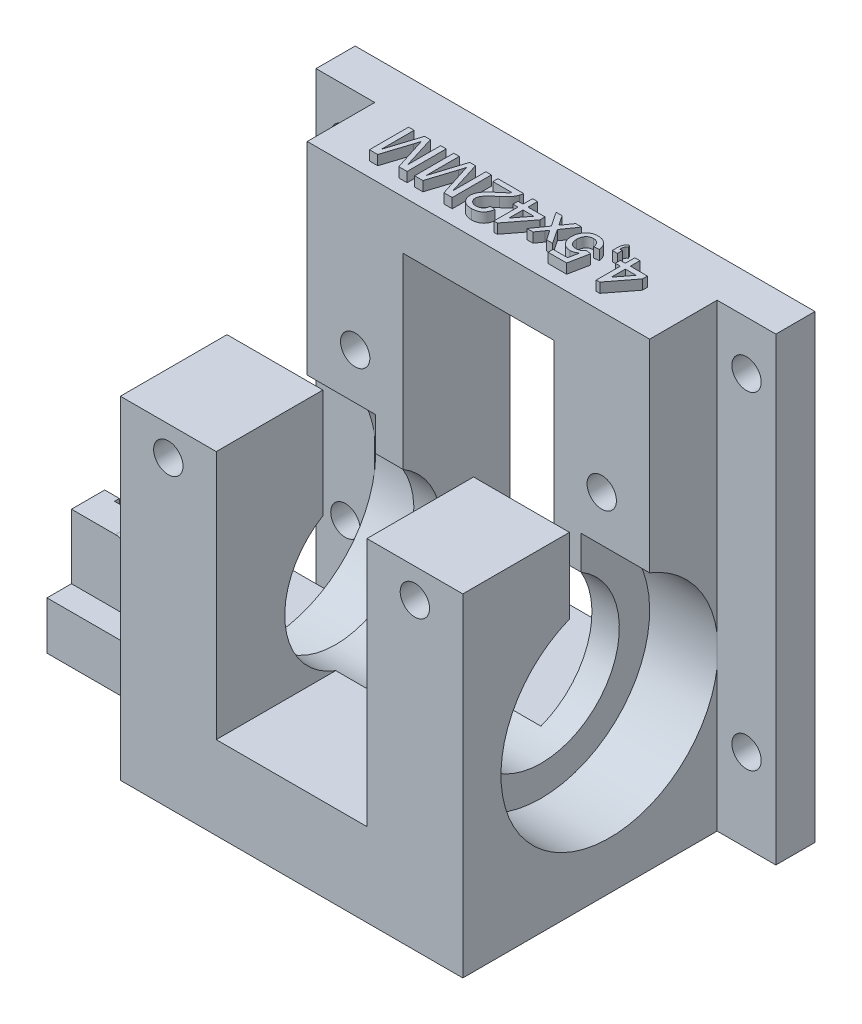
from build123d import *

# Parameters (mm, degrees)
SKETCH_1_W           = 35
SKETCH_1_H           = 30
EXTRUDE_1_DEPTH      = 42
SKETCH_2_W           = 15.4
SKETCH_2_H           = 30
CUT_EXTRUDE_1_DEPTH  = 33.5
SKETCH_3_R           = 11.1
CUT_EXTRUDE_2_DEPTH  = 7
CUT_EXTRUDE_START    = -7
SKETCH_4_R           = 11.1
CUT_EXTRUDE_3_DEPTH  = 7
SKETCH_5_R           = 8
CUT_EXTRUDE_4_DEPTH  = 53.659282183
SKETCH_6_W           = 35
SKETCH_6_H           = 8.2
CUT_EXTRUDE_5_DEPTH  = 20
SKETCH_7_R           = 1.5
CUT_EXTRUDE_6_DEPTH  = 55.5
SKETCH_9_W           = 15
SKETCH_9_H           = 4.9
EXTRUDE_2_DEPTH      = 15
SKETCH_10_W          = 6
SKETCH_10_H          = 10
EXTRUDE_3_DEPTH      = 6.6
CUT_EXTRUDE_8_DEPTH  = 1.3
SKETCH_12_W          = 3.2
SKETCH_12_H          = 10.2
CUT_EXTRUDE_9_DEPTH  = 1
SKETCH_14_W          = 35
SKETCH_14_H          = 10.9
EXTRUDE_4_DEPTH      = 5
SKETCH_15_W          = 9.8
SKETCH_15_H          = 10.9
CUT_EXTRUDE_10_DEPTH = 8
EXTRUDE_5_DEPTH      = 1
SKETCH_23_W          = 4
SKETCH_23_H          = 47
EXTRUDE_7_DEPTH      = 6
SKETCH_25_W          = 4
SKETCH_25_H          = 47
EXTRUDE_8_DEPTH      = 6
SKETCH_26_R          = 1.5
CUT_EXTRUDE_12_DEPTH = 66.270590694
SKETCH_27_R          = 3
CUT_EXTRUDE_13_DEPTH = 3
FILLET1_R            = 1.5


with BuildPart() as part:
    # Эскиз1 → Бобышка-Вытянуть1 (new body)
    with BuildSketch(Plane(origin=(0, 0, 0), x_dir=(1, 0, 0), z_dir=(0, 1, 0))):
        Rectangle(SKETCH_1_W, SKETCH_1_H)
    extrude(amount=EXTRUDE_1_DEPTH)

    # Эскиз2 → Вырез-Вытянуть1 (cut)
    with BuildSketch(Plane(origin=(0, 42, 0), x_dir=(1, 0, 0), z_dir=(0, 1, 0))):
        Rectangle(SKETCH_2_W, SKETCH_2_H)
    extrude(amount=-CUT_EXTRUDE_1_DEPTH, mode=Mode.SUBTRACT)

    # Эскиз3 → Вырез-Вытянуть2 (cut)
    with BuildSketch(Plane.ZY.offset(17.5)):
        with Locations((0, 16)):
            Circle(SKETCH_3_R)
    extrude(amount=-CUT_EXTRUDE_2_DEPTH, mode=Mode.SUBTRACT)

    # Эскиз4 → Вырез-Вытянуть3 (cut)
    with BuildSketch(Plane(origin=(17.5, 0, 0), x_dir=(0, 0, -1), z_dir=(1, 0, 0)).offset(CUT_EXTRUDE_START)):
        with Locations(Location((0, 16, 0), (0, 0, 180))):
            Circle(SKETCH_4_R)
    extrude(amount=CUT_EXTRUDE_3_DEPTH, mode=Mode.SUBTRACT)

    # Эскиз5 → Вырез-Вытянуть4 (cut, through all)
    with BuildSketch(Plane.ZY.offset(10.5)):
        with Locations((0, 16)):
            Circle(SKETCH_5_R)
    extrude(amount=-CUT_EXTRUDE_4_DEPTH, mode=Mode.SUBTRACT)

    # Эскиз6 → Вырез-Вытянуть5 (cut)
    with BuildSketch(Plane(origin=(0, 42, 0), x_dir=(1, 0, 0), z_dir=(0, 1, 0))):
        Rectangle(SKETCH_6_W, SKETCH_6_H)
    extrude(amount=-CUT_EXTRUDE_5_DEPTH, mode=Mode.SUBTRACT)

    # Эскиз7 → Вырез-Вытянуть6 (cut, through all)
    with BuildSketch(Plane(origin=(0, 0, -15), x_dir=(-1, 0, 0), z_dir=(0, 0, -1))):
        with Locations((-12.6, 31)):
            Circle(SKETCH_7_R)
        with Locations((12.6, 31)):
            Circle(SKETCH_7_R)
    extrude(amount=-CUT_EXTRUDE_6_DEPTH, mode=Mode.SUBTRACT)

    # Эскиз9 → Бобышка-Вытянуть2 (add)
    with BuildSketch(Plane(origin=(-17.5, 0, 0), x_dir=(0, 0, -1), z_dir=(1, 0, 0))):
        with Locations((0, 2.45)):
            Rectangle(SKETCH_9_W, SKETCH_9_H)
    extrude(amount=-EXTRUDE_2_DEPTH)

    # Эскиз10 → Бобышка-Вытянуть3 (add)
    with BuildSketch(Plane(origin=(0, 4.9, 0), x_dir=(1, 0, 0), z_dir=(0, 1, 0))):
        with Locations((-29.5, 0)):
            Rectangle(SKETCH_10_W, SKETCH_10_H)
    extrude(amount=EXTRUDE_3_DEPTH)

    # Эскиз11 → Вырез-Вытянуть8 (cut)
    with BuildSketch(Plane(origin=(0, 11.5, 0), x_dir=(1, 0, 0), z_dir=(0, 1, 0))):
        Polygon((-31, 1.6), (-32.5, 1.6), (-32.5, -1.6), (-31, -1.6), (-31, -2.1), (-28, -2.1), (-28, 2.1), (-31, 2.1), align=None)
    extrude(amount=-CUT_EXTRUDE_8_DEPTH, mode=Mode.SUBTRACT)

    # Эскиз12 → Вырез-Вытянуть9 (cut)
    with BuildSketch(Plane.ZY.offset(32.5)):
        with Locations((0, 5.1)):
            Rectangle(SKETCH_12_W, SKETCH_12_H)
    extrude(amount=-CUT_EXTRUDE_9_DEPTH, mode=Mode.SUBTRACT)

    # Эскиз14 → Бобышка-Вытянуть4 (add)
    with BuildSketch(Plane(origin=(0, 42, 0), x_dir=(1, 0, 0), z_dir=(0, 1, 0))):
        with Locations((0, 9.55)):
            Rectangle(SKETCH_14_W, SKETCH_14_H)
    extrude(amount=EXTRUDE_4_DEPTH)

    # Эскиз15 → Вырез-Вытянуть10 (cut)
    with BuildSketch(Plane(origin=(0, 42, 0), x_dir=(1, 0, 0), z_dir=(0, 1, 0))):
        with Locations((-12.6, -9.55)):
            Rectangle(SKETCH_15_W, SKETCH_15_H)
        with Locations((12.6, -9.55)):
            Rectangle(SKETCH_15_W, SKETCH_15_H)
    extrude(amount=-CUT_EXTRUDE_10_DEPTH, mode=Mode.SUBTRACT)

    # Эскиз17 → Бобышка-Вытянуть5 (add)
    # profile 1 of 8: a face of its own
    with BuildSketch(Plane(origin=(0, 47, 0), x_dir=(1, 0, 0), z_dir=(0, 1, 0))):
        Polygon((11.051282051, 9.55), (11.051282051, 8.575641026), (12.794871795, 8.575641026), (12.794871795, 8.062820513), (10.897435897, 5.601282051), (10.538461538, 5.601282051), (10.538461538, 8.062820513), (10.025641026, 8.062820513), (10.025641026, 8.575641026), (10.538461538, 8.575641026), (10.538461538, 9.55), align=None)
        Polygon((11.051282051, 8.062820513), (11.051282051, 6.622115385), (12.161858974, 8.062820513), align=None, mode=Mode.SUBTRACT)
    # profile 2 of 8: a face of its own
    with BuildSketch(Plane(origin=(0, 47, 0), x_dir=(1, 0, 0), z_dir=(0, 1, 0))):
        with BuildLine():
            Line((9.256410256, 9.55), (9.256410256, 9.037179487))
            Line((9.256410256, 9.037179487), (8.743589744, 9.037179487))
            Line((8.743589744, 9.037179487), (8.743589744, 9.55))
            add(Edge.make_bspline(
                [(8.743589744, 9.55), (8.744762203, 9.60080674), (8.746998436, 9.697710464), (8.765236115, 9.835295888), (8.795282204, 9.957567435), (8.837586451, 10.066022105), (8.895741676, 10.16039483), (8.967235433, 10.243648121), (9.053922116, 10.314994822), (9.120081135, 10.351752907), (9.153846154, 10.370512821)],
                knots=[0, 0, 0, 0, 1.252840278, 2.389542986, 3.415356866, 4.352460491, 5.24846073, 6.135967884, 7.048669687, 8, 8, 8, 8], degree=3))
            Line((9.153846154, 10.370512821), (9.256410256, 10.165384615))
            add(Edge.make_bspline(
                [(9.256410256, 10.165384615), (9.236136991, 10.15270943), (9.195793548, 10.127486034), (9.144116682, 10.077328516), (9.100530598, 10.019236479), (9.065074864, 9.951439544), (9.038948006, 9.871529248), (9.019447544, 9.777755567), (9.005956084, 9.668947552), (9.003109603, 9.591175547), (9.001602564, 9.55)],
                knots=[0, 0, 0, 0, 0.818684612, 1.629167986, 2.454191951, 3.302962822, 4.242204463, 5.329983798, 6.586388792, 8, 8, 8, 8], degree=3))
            Line((9.001602564, 9.55), (9.256410256, 9.55))
        make_face()
    # profile 3 of 8: a face of its own
    with BuildSketch(Plane(origin=(0, 47, 0), x_dir=(1, 0, 0), z_dir=(0, 1, 0))):
        with BuildLine():
            Line((7.974358974, 8.473076923), (7.461538462, 8.421794872))
            add(Edge.make_bspline(
                [(7.461538462, 8.421794872), (7.456460733, 8.450689493), (7.446583762, 8.506894026), (7.427762102, 8.588251754), (7.403318124, 8.663835357), (7.375852623, 8.734299433), (7.343205242, 8.798898912), (7.307831533, 8.858653786), (7.266115474, 8.911442943), (7.222256638, 8.960027307), (7.174118215, 9.002838723), (7.121235704, 9.038930225), (7.065084563, 9.070417874), (7.004980891, 9.096198562), (6.940832572, 9.115068668), (6.873456044, 9.129991683), (6.801983712, 9.137511319), (6.753218627, 9.138989984), (6.728365385, 9.13974359)],
                knots=[0, 0, 0, 0, 1.237781394, 2.407677316, 3.51963579, 4.58689595, 5.594855907, 6.570874, 7.510833816, 8.428091223, 9.330271693, 10.221190844, 11.124215526, 12.043132878, 12.973586933, 13.941700858, 14.950982896, 16, 16, 16, 16], degree=3))
            add(Edge.make_bspline(
                [(6.728365385, 9.13974359), (6.697879298, 9.138998436), (6.638262427, 9.137541256), (6.551476168, 9.125474441), (6.469793796, 9.104984114), (6.392440011, 9.078387527), (6.320650702, 9.041973623), (6.254638587, 8.99701751), (6.192074052, 8.946020266), (6.136594245, 8.885375865), (6.086108178, 8.81931477), (6.042530672, 8.747217103), (6.005845696, 8.670082001), (5.974960646, 8.587927748), (5.952154369, 8.500284059), (5.935378488, 8.40761745), (5.924609047, 8.309868818), (5.923594873, 8.242870598), (5.923076923, 8.208653846)],
                knots=[0, 0, 0, 0, 1.052750423, 2.05869932, 3.018624241, 3.958205853, 4.878289862, 5.789216265, 6.712947111, 7.659433357, 8.620775926, 9.5811884, 10.56329027, 11.567503128, 12.60809625, 13.686605721, 14.818523251, 16, 16, 16, 16], degree=3))
            add(Edge.make_bspline(
                [(5.923076923, 8.208653846), (5.923665617, 8.176045727), (5.92481194, 8.112550156), (5.934465851, 8.020090048), (5.950753135, 7.933149565), (5.971827355, 7.850770472), (6.00087551, 7.774240043), (6.035328257, 7.702448663), (6.077534321, 7.636919954), (6.124491351, 7.575613592), (6.178122208, 7.520654908), (6.239151436, 7.47424926), (6.305184894, 7.433634947), (6.377552563, 7.400699273), (6.456297057, 7.376229304), (6.540635873, 7.357401866), (6.631444151, 7.347499404), (6.69388974, 7.3457634), (6.725961538, 7.344871795)],
                knots=[0, 0, 0, 0, 1.165854935, 2.270189951, 3.319242023, 4.32700288, 5.306253956, 6.24172124, 7.169108591, 8.088047231, 8.999810445, 9.905349262, 10.822648491, 11.767237767, 12.739852311, 13.766490849, 14.852878837, 16, 16, 16, 16], degree=3))
            add(Edge.make_bspline(
                [(6.725961538, 7.344871795), (6.765831836, 7.346075377), (6.842557476, 7.348391528), (6.952581265, 7.366774493), (7.052239813, 7.397884441), (7.141490161, 7.441871146), (7.221133837, 7.496136836), (7.292349446, 7.558219874), (7.357127652, 7.626487707), (7.39247764, 7.677959269), (7.41025641, 7.703846154)],
                knots=[0, 0, 0, 0, 1.182595606, 2.275764447, 3.298426239, 4.269611407, 5.217028086, 6.149744883, 7.069440711, 8, 8, 8, 8], degree=3))
            Line((7.41025641, 7.703846154), (7.923076923, 7.652564103))
            Line((7.923076923, 7.652564103), (7.512820513, 5.601282051))
            Line((7.512820513, 5.601282051), (5.615384615, 5.601282051))
            Line((5.615384615, 5.601282051), (5.615384615, 6.114102564))
            Line((5.615384615, 6.114102564), (7.09375, 6.114102564))
            Line((7.09375, 6.114102564), (7.297275641, 7.150160256))
            add(Edge.make_bspline(
                [(7.297275641, 7.150160256), (7.268978306, 7.128929634), (7.213406817, 7.087236051), (7.126747153, 7.032591296), (7.038983143, 6.986841178), (6.950576337, 6.948546155), (6.860301127, 6.919728313), (6.769141059, 6.899121223), (6.676964847, 6.88537448), (6.615166257, 6.884015656), (6.584134615, 6.883333333)],
                knots=[0, 0, 0, 0, 1.093799738, 2.148049664, 3.164132611, 4.152263193, 5.124065093, 6.089950765, 7.040884846, 8, 8, 8, 8], degree=3))
            add(Edge.make_bspline(
                [(6.584134615, 6.883333333), (6.543748064, 6.884391846), (6.464217151, 6.886476314), (6.347021786, 6.903592241), (6.234978069, 6.932674585), (6.127137436, 6.971751814), (6.025308421, 7.023832328), (5.927334208, 7.085605854), (5.835155558, 7.16005899), (5.748365663, 7.244413035), (5.669029336, 7.337778469), (5.600276379, 7.439053291), (5.541050547, 7.546436856), (5.493068907, 7.660316925), (5.456004725, 7.780892463), (5.429974508, 7.907543666), (5.413427229, 8.040751555), (5.411329647, 8.131680793), (5.41025641, 8.178205128)],
                knots=[0, 0, 0, 0, 0.991915953, 1.953323076, 2.9018799, 3.831962974, 4.765165785, 5.70629427, 6.67268229, 7.670376632, 8.67608782, 9.677121355, 10.672677061, 11.684236821, 12.707498642, 13.766656378, 14.857300131, 16, 16, 16, 16], degree=3))
            add(Edge.make_bspline(
                [(5.41025641, 8.178205128), (5.411156001, 8.222583072), (5.412932951, 8.310242175), (5.427752663, 8.439380631), (5.451534872, 8.564053302), (5.485561261, 8.683683722), (5.527786942, 8.799330016), (5.581285743, 8.909565964), (5.642451314, 9.016580163), (5.691606696, 9.082518807), (5.716346154, 9.115705128)],
                knots=[0, 0, 0, 0, 1.059762356, 2.093333049, 3.100576568, 4.08823236, 5.061210495, 6.037154334, 7.012117566, 8, 8, 8, 8], degree=3))
            add(Edge.make_bspline(
                [(5.716346154, 9.115705128), (5.747771179, 9.154439921), (5.809587576, 9.230635417), (5.916555204, 9.329653668), (6.031909427, 9.413416188), (6.154974873, 9.483107829), (6.287290682, 9.536524881), (6.428159547, 9.573425407), (6.577145806, 9.597839493), (6.679387351, 9.600118743), (6.731570513, 9.601282051)],
                knots=[0, 0, 0, 0, 1.023063757, 2.01247625, 2.982117532, 3.944599247, 4.908953799, 5.902627458, 6.929519989, 8, 8, 8, 8], degree=3))
            add(Edge.make_bspline(
                [(6.731570513, 9.601282051), (6.774615114, 9.600406486), (6.858818996, 9.598693703), (6.98212694, 9.583877782), (7.099337418, 9.560077146), (7.210909624, 9.526516179), (7.315783802, 9.48202305), (7.415429606, 9.429357654), (7.507610872, 9.365184154), (7.594184528, 9.293303776), (7.67336044, 9.213562045), (7.743516838, 9.126412248), (7.804411227, 9.03273972), (7.858083566, 8.933562687), (7.899810221, 8.826848145), (7.934761175, 8.714806315), (7.960674347, 8.596312118), (7.969749603, 8.514586039), (7.974358974, 8.473076923)],
                knots=[0, 0, 0, 0, 1.109091339, 2.169605288, 3.195665858, 4.188679546, 5.166738875, 6.127665597, 7.0881237, 8.055905583, 9.024592931, 9.979285586, 10.933953421, 11.900951517, 12.880148814, 13.881763063, 14.92413606, 16, 16, 16, 16], degree=3))
        make_face()
    # profile 4 of 8: a face of its own
    with BuildSketch(Plane(origin=(0, 47, 0), x_dir=(1, 0, 0), z_dir=(0, 1, 0))):
        with BuildLine():
            Line((5.102564103, 9.55), (4.076923077, 8.088461538))
            Line((4.076923077, 8.088461538), (5.051282051, 6.626923077))
            Line((5.051282051, 6.626923077), (4.436698718, 6.626923077))
            Line((4.436698718, 6.626923077), (3.963141026, 7.336057692))
            add(Edge.make_bspline(
                [(3.963141026, 7.336057692), (3.943145685, 7.366263796), (3.905403959, 7.423278603), (3.851487363, 7.503520103), (3.804239172, 7.574051249), (3.774842718, 7.617843871), (3.761217949, 7.638141026)],
                knots=[0, 0, 0, 0, 1.196329119, 2.258102392, 3.192659312, 4, 4, 4, 4], degree=3))
            add(Edge.make_bspline(
                [(3.761217949, 7.638141026), (3.728351968, 7.591408991), (3.662834044, 7.498249262), (3.597476074, 7.404977245), (3.564903846, 7.35849359)],
                knots=[0, 0, 0, 0, 1.003266858, 2, 2, 2, 2], degree=3))
            Line((3.564903846, 7.35849359), (3.051282051, 6.626923077))
            Line((3.051282051, 6.626923077), (2.4375, 6.626923077))
            Line((2.4375, 6.626923077), (3.462339744, 8.087660256))
            Line((3.462339744, 8.087660256), (2.487179487, 9.55))
            Line((2.487179487, 9.55), (3.101762821, 9.55))
            Line((3.101762821, 9.55), (3.670673077, 8.696634615))
            Line((3.670673077, 8.696634615), (3.778044872, 8.537980769))
            Line((3.778044872, 8.537980769), (4.487980769, 9.55))
            Line((4.487980769, 9.55), (5.102564103, 9.55))
        make_face()
    # profile 5 of 8: a face of its own
    with BuildSketch(Plane(origin=(0, 47, 0), x_dir=(1, 0, 0), z_dir=(0, 1, 0))):
        Polygon((0.58974359, 9.55), (0.58974359, 8.575641026), (2.333333333, 8.575641026), (2.333333333, 8.062820513), (0.435897436, 5.601282051), (0.076923077, 5.601282051), (0.076923077, 8.062820513), (-0.435897436, 8.062820513), (-0.435897436, 8.575641026), (0.076923077, 8.575641026), (0.076923077, 9.55), align=None)
        Polygon((0.58974359, 8.062820513), (0.58974359, 6.622115385), (1.700320513, 8.062820513), align=None, mode=Mode.SUBTRACT)
    # profile 6 of 8: a face of its own
    with BuildSketch(Plane(origin=(0, 47, 0), x_dir=(1, 0, 0), z_dir=(0, 1, 0))):
        with BuildLine():
            Line((-3.461538462, 9.037179487), (-3.461538462, 9.55))
            Line((-3.461538462, 9.55), (-0.846153846, 9.55))
            add(Edge.make_bspline(
                [(-0.846153846, 9.55), (-0.846082735, 9.519519453), (-0.845941371, 9.458926348), (-0.856451896, 9.368959417), (-0.872291123, 9.280102742), (-0.890639052, 9.222910301), (-0.899839744, 9.194230769)],
                knots=[0, 0, 0, 0, 1.010600758, 2.009000657, 3.001600101, 4, 4, 4, 4], degree=3))
            add(Edge.make_bspline(
                [(-0.899839744, 9.194230769), (-0.916779692, 9.147353172), (-0.951190909, 9.052127668), (-1.021694058, 8.914539873), (-1.104395846, 8.777782713), (-1.18460512, 8.665929608), (-1.25815358, 8.577261327), (-1.318832327, 8.507068152), (-1.387177214, 8.4361128), (-1.461952315, 8.36313594), (-1.542700917, 8.288131646), (-1.629420726, 8.210750893), (-1.723168438, 8.13246432), (-1.7886128, 8.080571583), (-1.822115385, 8.05400641)],
                knots=[0, 0, 0, 0, 1.204775845, 2.447339333, 3.731688634, 5.069474332, 5.771881205, 6.518320379, 7.313534551, 8.154278236, 9.045805008, 9.979490009, 10.965651065, 12, 12, 12, 12], degree=3))
            add(Edge.make_bspline(
                [(-1.822115385, 8.05400641), (-1.873583803, 8.010686271), (-1.972689508, 7.927270595), (-2.112642371, 7.803489508), (-2.240466257, 7.688551596), (-2.354126908, 7.580443046), (-2.454550075, 7.480210154), (-2.541983882, 7.388087306), (-2.617141923, 7.304339128), (-2.679226482, 7.226005854), (-2.731197355, 7.152053321), (-2.776319435, 7.080316644), (-2.812541985, 7.008283907), (-2.843626375, 6.937323066), (-2.867741932, 6.867153892), (-2.884713823, 6.797147878), (-2.895681037, 6.727967714), (-2.896857451, 6.681716305), (-2.897435897, 6.658974359)],
                knots=[0, 0, 0, 0, 1.782511555, 3.432339066, 4.950556168, 6.337242158, 7.588364383, 8.709771971, 9.70247892, 10.569050646, 11.3564271, 12.096888545, 12.812232926, 13.490631961, 14.148641375, 14.7751826, 15.397753892, 16, 16, 16, 16], degree=3))
            add(Edge.make_bspline(
                [(-2.897435897, 6.658974359), (-2.896879163, 6.636494046), (-2.89578688, 6.592388895), (-2.885421202, 6.527842176), (-2.87099607, 6.465678688), (-2.847656894, 6.40703374), (-2.819938503, 6.350109704), (-2.784024488, 6.296761456), (-2.743372767, 6.244972349), (-2.695881727, 6.197454776), (-2.64437183, 6.152921146), (-2.587038785, 6.115707339), (-2.52657792, 6.083233275), (-2.462464322, 6.05676427), (-2.39421562, 6.036629538), (-2.32231158, 6.022524983), (-2.246489973, 6.01342694), (-2.194738127, 6.012177498), (-2.168269231, 6.011538462)],
                knots=[0, 0, 0, 0, 0.987999173, 1.938400644, 2.870175051, 3.788745887, 4.708217872, 5.649938364, 6.61138593, 7.600013579, 8.600369295, 9.600725011, 10.599354487, 11.616065131, 12.645726306, 13.724038792, 14.835941382, 16, 16, 16, 16], degree=3))
            add(Edge.make_bspline(
                [(-2.168269231, 6.011538462), (-2.140465958, 6.012178615), (-2.086052911, 6.013431441), (-2.006502895, 6.022505424), (-1.931031689, 6.036484496), (-1.859837716, 6.057377903), (-1.79343005, 6.085090247), (-1.730298763, 6.116672913), (-1.672120047, 6.155686717), (-1.61882603, 6.200662994), (-1.569496464, 6.249756283), (-1.527853004, 6.305255231), (-1.491169963, 6.364389666), (-1.462860375, 6.429200021), (-1.439189909, 6.497660549), (-1.422317066, 6.570946029), (-1.413059075, 6.648857951), (-1.411204191, 6.702220684), (-1.41025641, 6.729487179)],
                knots=[0, 0, 0, 0, 1.131007971, 2.213465715, 3.25352735, 4.250693176, 5.225400803, 6.177988609, 7.118348849, 8.067272485, 9.012455277, 9.942714685, 10.883890855, 11.837222194, 12.81320114, 13.828092093, 14.890230783, 16, 16, 16, 16], degree=3))
            Line((-1.41025641, 6.729487179), (-0.897435897, 6.678205128))
            add(Edge.make_bspline(
                [(-0.897435897, 6.678205128), (-0.902682148, 6.633511111), (-0.912888276, 6.546562747), (-0.938322126, 6.420640269), (-0.973985758, 6.303468047), (-1.016806537, 6.193542674), (-1.070028073, 6.092144418), (-1.132080914, 5.998963916), (-1.201772535, 5.912932004), (-1.281651179, 5.837210809), (-1.36861221, 5.769133514), (-1.463516346, 5.710944199), (-1.565313196, 5.660697713), (-1.674316407, 5.620003899), (-1.7905577, 5.588840701), (-1.913835182, 5.566554173), (-2.044294277, 5.552801079), (-2.133779886, 5.550947015), (-2.179487179, 5.55)],
                knots=[0, 0, 0, 0, 1.130828508, 2.199929528, 3.223633236, 4.205997909, 5.160910297, 6.095620583, 7.016241394, 7.937376102, 8.855913919, 9.787436367, 10.73018861, 11.705300542, 12.706861604, 13.751074331, 14.851297925, 16, 16, 16, 16], degree=3))
            add(Edge.make_bspline(
                [(-2.179487179, 5.55), (-2.225741232, 5.550792323), (-2.315844398, 5.552335771), (-2.447141617, 5.568119175), (-2.571015121, 5.592720915), (-2.687960685, 5.626942232), (-2.797357101, 5.672137793), (-2.899578502, 5.726571863), (-2.99430275, 5.791179471), (-3.080238246, 5.865680577), (-3.157750046, 5.947040368), (-3.225520375, 6.033937345), (-3.28283039, 6.125747007), (-3.329330768, 6.222266479), (-3.366034453, 6.323411438), (-3.390931794, 6.42940932), (-3.408133355, 6.54009289), (-3.409539317, 6.615636557), (-3.41025641, 6.654166667)],
                knots=[0, 0, 0, 0, 1.195184963, 2.328227347, 3.412838735, 4.457075639, 5.472567195, 6.467212925, 7.445817268, 8.429862391, 9.40172103, 10.346392722, 11.273671097, 12.19390528, 13.111181922, 14.048965502, 15.00489906, 16, 16, 16, 16], degree=3))
            add(Edge.make_bspline(
                [(-3.41025641, 6.654166667), (-3.409177564, 6.693755674), (-3.40701749, 6.773021054), (-3.389440224, 6.89133178), (-3.361425519, 7.008540721), (-3.321690521, 7.125725416), (-3.26782673, 7.243512483), (-3.200346554, 7.364055347), (-3.116792857, 7.486526692), (-3.036708456, 7.590771671), (-2.962057858, 7.678045626), (-2.895335383, 7.750039796), (-2.819088482, 7.827693393), (-2.733561398, 7.910748414), (-2.638345813, 7.999021549), (-2.534675981, 8.093615681), (-2.42060373, 8.192635602), (-2.341395174, 8.260261046), (-2.300480769, 8.295192308)],
                knots=[0, 0, 0, 0, 0.92705835, 1.85616256, 2.795554264, 3.747284035, 4.749796966, 5.825476635, 6.979499781, 8.219726678, 8.903135141, 9.669166345, 10.518679137, 11.452302006, 12.461664484, 13.560176038, 14.739732795, 16, 16, 16, 16], degree=3))
            add(Edge.make_bspline(
                [(-2.300480769, 8.295192308), (-2.265376068, 8.323632107), (-2.198303809, 8.377970175), (-2.104154471, 8.457891049), (-2.018131649, 8.529130419), (-1.941408883, 8.592833141), (-1.874405456, 8.649747699), (-1.818010926, 8.700563375), (-1.76963496, 8.742669999), (-1.697323119, 8.808927046), (-1.605337729, 8.902681191), (-1.537302368, 8.993705132), (-1.504807692, 9.037179487)],
                knots=[0, 0, 0, 0, 1.242120814, 2.373239094, 3.395283395, 4.312960318, 5.115054069, 5.812109485, 6.400004863, 6.878180934, 8.508973911, 10, 10, 10, 10], degree=3))
            Line((-1.504807692, 9.037179487), (-3.461538462, 9.037179487))
        make_face()
    # profile 7 of 8: a face of its own
    with BuildSketch(Plane(origin=(0, 47, 0), x_dir=(1, 0, 0), z_dir=(0, 1, 0))):
        with BuildLine():
            Line((-4.128205128, 9.55), (-4.128205128, 5.55))
            Line((-4.128205128, 5.55), (-4.976762821, 5.55))
            Line((-4.976762821, 5.55), (-5.87099359, 8.356891026))
            add(Edge.make_bspline(
                [(-5.87099359, 8.356891026), (-5.880834637, 8.388688209), (-5.899866651, 8.450182111), (-5.928088868, 8.538984965), (-5.953766355, 8.621507311), (-5.976892975, 8.698011825), (-5.998717865, 8.768118663), (-6.017614781, 8.832403106), (-6.035680848, 8.890150808), (-6.04626837, 8.926851361), (-6.051282051, 8.944230769)],
                knots=[0, 0, 0, 0, 1.300204174, 2.514519184, 3.639827924, 4.676153899, 5.636536826, 6.507959918, 7.293450077, 8, 8, 8, 8], degree=3))
            add(Edge.make_bspline(
                [(-6.051282051, 8.944230769), (-6.056866128, 8.925259626), (-6.068749399, 8.88488782), (-6.088014083, 8.821410075), (-6.108512254, 8.751164808), (-6.133042282, 8.675359419), (-6.158611933, 8.592804761), (-6.185450609, 8.503569392), (-6.2164085, 8.408544221), (-6.236981565, 8.342756834), (-6.247596154, 8.308814103)],
                knots=[0, 0, 0, 0, 0.713638162, 1.518667645, 2.393860736, 3.354087503, 4.393659122, 5.512594909, 6.716633584, 8, 8, 8, 8], degree=3))
            Line((-6.247596154, 8.308814103), (-7.133012821, 5.55))
            Line((-7.133012821, 5.55), (-7.974358974, 5.55))
            Line((-7.974358974, 5.55), (-7.974358974, 9.55))
            Line((-7.974358974, 9.55), (-7.41025641, 9.55))
            Line((-7.41025641, 9.55), (-7.41025641, 6.165384615))
            Line((-7.41025641, 6.165384615), (-6.342948718, 9.55))
            Line((-6.342948718, 9.55), (-5.753205128, 9.55))
            Line((-5.753205128, 9.55), (-4.692307692, 6.165384615))
            Line((-4.692307692, 6.165384615), (-4.692307692, 9.55))
            Line((-4.692307692, 9.55), (-4.128205128, 9.55))
        make_face()
    # profile 8 of 8: a face of its own
    with BuildSketch(Plane(origin=(0, 47, 0), x_dir=(1, 0, 0), z_dir=(0, 1, 0))):
        with BuildLine():
            Line((-8.743589744, 9.55), (-8.743589744, 5.55))
            Line((-8.743589744, 5.55), (-9.592147436, 5.55))
            Line((-9.592147436, 5.55), (-10.486378205, 8.356891026))
            add(Edge.make_bspline(
                [(-10.486378205, 8.356891026), (-10.496219253, 8.388688209), (-10.515251266, 8.450182111), (-10.543473484, 8.538984965), (-10.56915097, 8.621507311), (-10.592277591, 8.698011825), (-10.614102481, 8.768118663), (-10.632999397, 8.832403106), (-10.651065463, 8.890150808), (-10.661652986, 8.926851361), (-10.666666667, 8.944230769)],
                knots=[0, 0, 0, 0, 1.300204174, 2.514519184, 3.639827924, 4.676153899, 5.636536826, 6.507959918, 7.293450077, 8, 8, 8, 8], degree=3))
            add(Edge.make_bspline(
                [(-10.666666667, 8.944230769), (-10.672250743, 8.925259626), (-10.684134015, 8.88488782), (-10.703398698, 8.821410075), (-10.723896869, 8.751164808), (-10.748426897, 8.675359419), (-10.773996548, 8.592804761), (-10.800835225, 8.503569392), (-10.831793115, 8.408544221), (-10.852366181, 8.342756834), (-10.862980769, 8.308814103)],
                knots=[0, 0, 0, 0, 0.713638162, 1.518667645, 2.393860736, 3.354087503, 4.393659122, 5.512594909, 6.716633584, 8, 8, 8, 8], degree=3))
            Line((-10.862980769, 8.308814103), (-11.748397436, 5.55))
            Line((-11.748397436, 5.55), (-12.58974359, 5.55))
            Line((-12.58974359, 5.55), (-12.58974359, 9.55))
            Line((-12.58974359, 9.55), (-12.025641026, 9.55))
            Line((-12.025641026, 9.55), (-12.025641026, 6.165384615))
            Line((-12.025641026, 6.165384615), (-10.958333333, 9.55))
            Line((-10.958333333, 9.55), (-10.368589744, 9.55))
            Line((-10.368589744, 9.55), (-9.307692308, 6.165384615))
            Line((-9.307692308, 6.165384615), (-9.307692308, 9.55))
            Line((-9.307692308, 9.55), (-8.743589744, 9.55))
        make_face()
    extrude(amount=EXTRUDE_5_DEPTH)

    # Эскиз23 → Бобышка-Вытянуть7 (add)
    with BuildSketch(Plane(origin=(17.5, 0, 0), x_dir=(0, 0, -1), z_dir=(1, 0, 0))):
        with Locations((13, 23.5)):
            Rectangle(SKETCH_23_W, SKETCH_23_H)
    extrude(amount=EXTRUDE_7_DEPTH)

    # Эскиз25 → Бобышка-Вытянуть8 (add)
    with BuildSketch(Plane.ZY.offset(17.5)):
        with Locations((-13, 23.5)):
            Rectangle(SKETCH_25_W, SKETCH_25_H)
    extrude(amount=EXTRUDE_8_DEPTH)

    # Эскиз26 → Вырез-Вытянуть12 (cut, through all)
    with BuildSketch(Plane(origin=(0, 0, -15), x_dir=(-1, 0, 0), z_dir=(0, 0, -1))):
        with Locations((-20.5, 42)):
            Circle(SKETCH_26_R)
        with Locations((-20.5, 8.5)):
            Circle(SKETCH_26_R)
        with Locations((20.5, 42)):
            Circle(SKETCH_26_R)
        with Locations((20.5, 8.5)):
            Circle(SKETCH_26_R)
    extrude(amount=-CUT_EXTRUDE_12_DEPTH, mode=Mode.SUBTRACT)

    # Эскиз27 → Вырез-Вытянуть13 (cut)
    with BuildSketch(Plane(origin=(0, 0, -15), x_dir=(-1, 0, 0), z_dir=(0, 0, -1))):
        with Locations((12.6, 31)):
            Circle(SKETCH_27_R)
        with Locations((-12.6, 31)):
            Circle(SKETCH_27_R)
    extrude(amount=-CUT_EXTRUDE_13_DEPTH, mode=Mode.SUBTRACT)

    # Fillet1
    fillet1_edges = [part.edges().sort_by_distance(p)[0] for p in [
        (-26.5, 11.5, 0),
    ]]
    fillet(fillet1_edges, radius=FILLET1_R - 0.0001)  # a hair under: the kernel refuses the full size


solid = part.part
